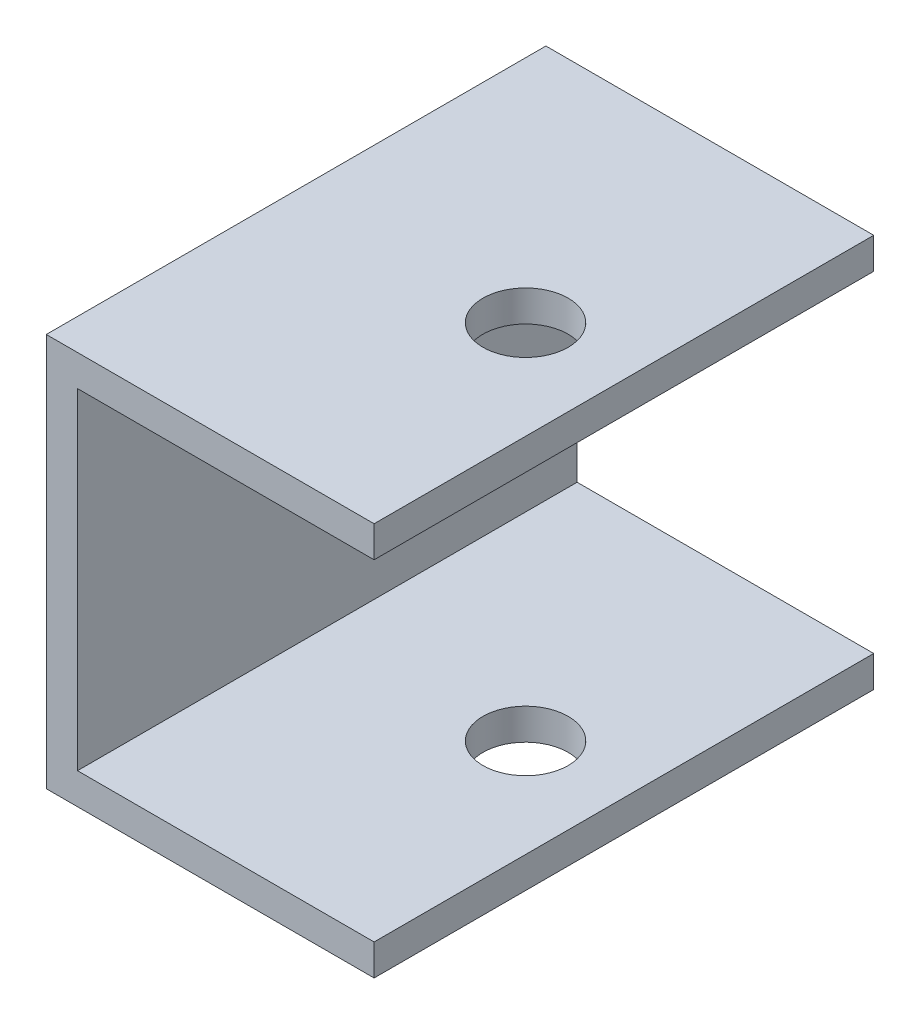
from build123d import *

# Parameters (mm, degrees)
SALIENTE_EXTRUIR3_DEPTH = 38.1
CROQUIS7_R              = 5.55625
CORTAR_EXTRUIR1_DEPTH   = 5
CROQUIS8_R              = 6.5
CORTAR_EXTRUIR2_DEPTH   = 70


with BuildPart() as part:
    # Croquis6 → Saliente-Extruir3 (new, symmetric)
    with BuildSketch(Plane.XY):
        Polygon((45.2375, 25.2375), (0, 25.2375), (0, -25.2375), (45.2375, -25.2375), (45.2375, -30), (-4.7625, -30), (-4.7625, 30), (45.2375, 30), align=None)
    extrude(amount=SALIENTE_EXTRUIR3_DEPTH, both=True)

    # Croquis7 → Cortar-Extruir1 (cut)
    with BuildSketch(Plane.ZY.offset(4.7625)):
        Circle(CROQUIS7_R)
    extrude(amount=-CORTAR_EXTRUIR1_DEPTH, mode=Mode.SUBTRACT)

    # Croquis8 → Cortar-Extruir2 (cut)
    with BuildSketch(Plane.XZ.offset(30)):
        with Locations((30.2375, 0)):
            Circle(CROQUIS8_R)
    extrude(amount=-CORTAR_EXTRUIR2_DEPTH, mode=Mode.SUBTRACT)


solid = part.part
